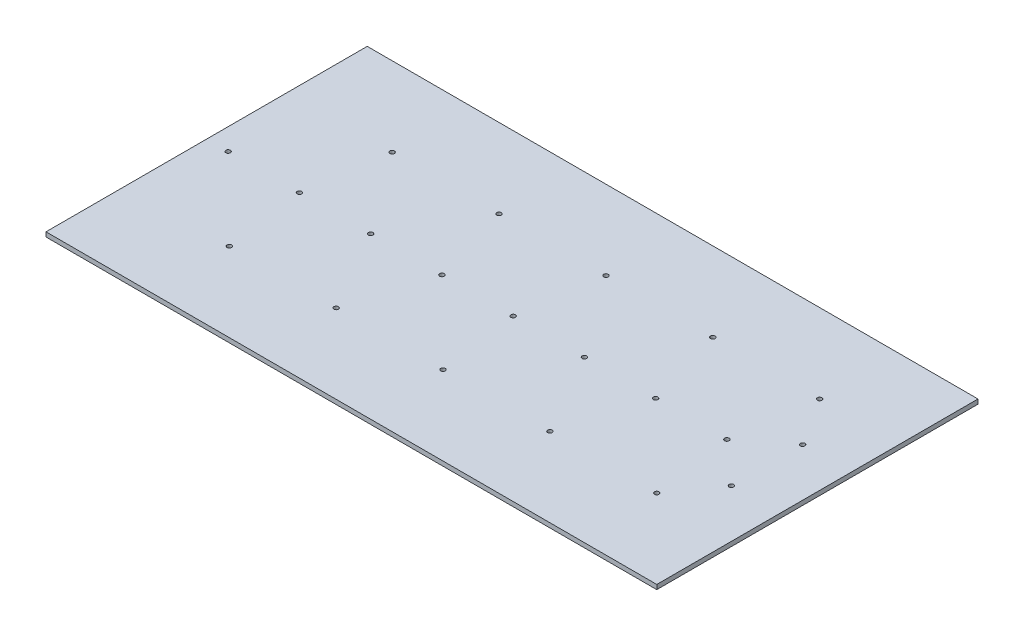
from build123d import *

# Parameters (mm, degrees)
SKETCH1_W               = 857.25
SKETCH1_H               = 450.85
BOSS_EXTRUDE1_DEPTH     = 6.35
CUT_EXTRUDE1_DEPTH      = 969.598785618
CUT_EXTRUDE1_DEPTH_BACK = 969.598785618
SKETCH2_R               = 3.175


with BuildPart() as part:
    # Sketch1 → Boss-Extrude1 (new body)
    with BuildSketch(Plane(origin=(0, 0, 0), x_dir=(1, 0, 0), z_dir=(0, 1, 0))):
        with Locations((428.625, 225.425)):
            Rectangle(SKETCH1_W, SKETCH1_H)
    extrude(amount=BOSS_EXTRUDE1_DEPTH)

    # Sketch2 → Cut-Extrude1 (cut, two sides: drawn at the far end of the back side and taken through both)
    with BuildSketch(Plane(origin=(0, 6.35, 0), x_dir=(1, 0, 0), z_dir=(0, 1, 0)).offset(-CUT_EXTRUDE1_DEPTH_BACK)):
        with Locations((30.25, 225.425)):
            Circle(SKETCH2_R)
        with Locations((130.25, 225.425)):
            Circle(SKETCH2_R)
        with Locations((230.25, 225.425)):
            Circle(SKETCH2_R)
        with Locations((330.25, 225.425)):
            Circle(SKETCH2_R)
        with Locations((430.25, 225.425)):
            Circle(SKETCH2_R)
        with Locations((530.25, 225.425)):
            Circle(SKETCH2_R)
        with Locations((630.25, 225.425)):
            Circle(SKETCH2_R)
        with Locations((730.25, 225.425)):
            Circle(SKETCH2_R)
        with Locations((146.163, 339.725)):
            Circle(SKETCH2_R)
        with Locations((296.163, 339.725)):
            Circle(SKETCH2_R)
        with Locations((446.163, 339.725)):
            Circle(SKETCH2_R)
        with Locations((596.163, 339.725)):
            Circle(SKETCH2_R)
        with Locations((746.163, 339.725)):
            Circle(SKETCH2_R)
        with Locations((146.163, 111.125)):
            Circle(SKETCH2_R)
        with Locations((296.163, 111.125)):
            Circle(SKETCH2_R)
        with Locations((446.163, 111.125)):
            Circle(SKETCH2_R)
        with Locations((596.163, 111.125)):
            Circle(SKETCH2_R)
        with Locations((746.163, 111.125)):
            Circle(SKETCH2_R)
        with Locations((789.66304, 172.32376)):
            Circle(SKETCH2_R)
        with Locations((789.66304, 272.32356)):
            Circle(SKETCH2_R)
    extrude(amount=CUT_EXTRUDE1_DEPTH + CUT_EXTRUDE1_DEPTH_BACK, mode=Mode.SUBTRACT)


solid = part.part
